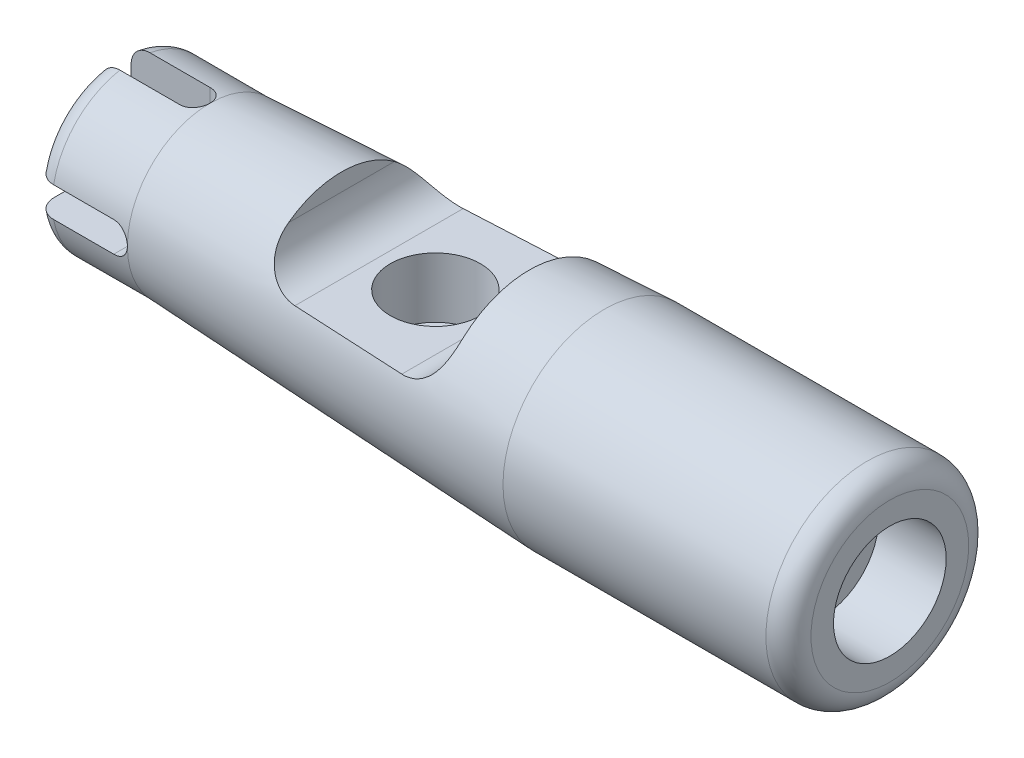
from build123d import *

# Parameters (mm, degrees)
CUT_EXTRUDE1_DEPTH                       = 210.50894969
FILLET1_R                                = 5
CIRPATTERN1_COUNT                        = 2
CIRPATTERN1_ANGLE                        = 90
CBORE_FOR_M30_HEX_HEAD_BOLT2_D           = 12
CBORE_FOR_M30_HEX_HEAD_BOLT2_DEPTH       = 38
CBORE_FOR_M30_HEX_HEAD_BOLT2_CBORE_D     = 30
CBORE_FOR_M30_HEX_HEAD_BOLT2_CBORE_DEPTH = 18
CBORE_FOR_M30_HEX_HEAD_BOLT2_TIP         = 3.605163714
FILLET2_R                                = 6
CUT_EXTRUDE2_DEPTH                       = 210.508949801
CUT_EXTRUDE2_DEPTH_BACK                  = 210.508949801
SKETCH10_W                               = 60
SKETCH10_H                               = 5
FILLET3_R                                = 5
CUT_EXTRUDE3_DEPTH                       = 214.461940534
CUT_EXTRUDE3_DEPTH_BACK                  = 12
SKETCH11_R                               = 3
CUT_EXTRUDE4_DEPTH                       = 210.508949814
CUT_EXTRUDE4_DEPTH_BACK                  = 210.508949814
SKETCH12_W                               = 50
SKETCH12_H                               = 18
FILLET4_R                                = 10
SKETCH13_R                               = 12
CUT_EXTRUDE5_DEPTH                       = 16


with BuildPart() as part:
    # Sketch1 → Revolve1 (revolve)
    with BuildSketch(Plane.XY, mode=Mode.PRIVATE) as revolve1_sk:
        Polygon((0, 0), (0, 27), (-76, 27), (-181, 22), (-206, 22), (-206, 0), align=None)
    revolve(revolve1_sk.sketch.rotate(Axis((0, 0, 0), (-1, 0, 0)), 90), axis=Axis((0, 0, 0), (-1, 0, 0)))

    # Sketch2 → Cut-Extrude1 (cut, symmetric)
    with BuildSketch(Plane.XY):
        with BuildLine():
            Line((-206, 4), (-185, 4))
            ThreePointArc((-185, 4), (-181, 0), (-185, -4))
            Line((-185, -4), (-206, -4))
            ThreePointArc((-206, -4), (-210, 0), (-206, 4))
        make_face()
    cut_extrude1 = extrude(amount=CUT_EXTRUDE1_DEPTH, both=True, mode=Mode.SUBTRACT)

    # Fillet1
    fillet1_edges = [part.edges().sort_by_distance(p)[0] for p in [
        (-206, -22, 0),
        (-206, 22, 0),
    ]]
    fillet(fillet1_edges, radius=FILLET1_R)

    # CirPattern1: Cut-Extrude1 ×2 about axis
    cirpattern1_axis = Axis((0, 0, 0), (1, 0, 0))
    for i in range(1, CIRPATTERN1_COUNT):
        add(cut_extrude1.rotate(cirpattern1_axis, i * CIRPATTERN1_ANGLE / (CIRPATTERN1_COUNT - 1)), mode=Mode.SUBTRACT)

    # CBORE for M30 Hex Head Bolt2
    with Locations(Plane(origin=(0, 0, 0), x_dir=(0, 0, -1), z_dir=(1, 0, 0))):
        with Locations((0, 0)):
            CounterBoreHole(CBORE_FOR_M30_HEX_HEAD_BOLT2_D / 2, CBORE_FOR_M30_HEX_HEAD_BOLT2_CBORE_D / 2, CBORE_FOR_M30_HEX_HEAD_BOLT2_CBORE_DEPTH, depth=CBORE_FOR_M30_HEX_HEAD_BOLT2_DEPTH)
            with Locations((0, 0, -(CBORE_FOR_M30_HEX_HEAD_BOLT2_DEPTH + CBORE_FOR_M30_HEX_HEAD_BOLT2_TIP / 2))):  # 118° drill point
                Cone(0, CBORE_FOR_M30_HEX_HEAD_BOLT2_D / 2, CBORE_FOR_M30_HEX_HEAD_BOLT2_TIP, mode=Mode.SUBTRACT)

    # Fillet2
    fillet2_edges = [part.edges().sort_by_distance(p)[0] for p in [
        (0, 0, 27),
    ]]
    fillet(fillet2_edges, radius=FILLET2_R)

    # Sketch10 → Cut-Extrude2 (cut, two sides: drawn at the far end of the back side and taken through both)
    with BuildSketch(Plane.XY.offset(-CUT_EXTRUDE2_DEPTH_BACK)):
        with Locations((-46, -24.5)):
            Rectangle(SKETCH10_W, SKETCH10_H)
    extrude(amount=CUT_EXTRUDE2_DEPTH + CUT_EXTRUDE2_DEPTH_BACK, mode=Mode.SUBTRACT)

    # Fillet3
    # the kernel refuses this fillet: 5 mm, written as the material it adds along each edge
    with BuildSketch(Plane(origin=(-16, -22, -28.152475842), x_dir=(0, -1, 0), z_dir=(0, 0, 1))) as fillet3_piece_1_section:
        with BuildLine():
            CenterArc((FILLET3_R, -FILLET3_R), FILLET3_R, 90, 90)
            Line((0, -FILLET3_R), (0, 0))
            Line((0, 0), (FILLET3_R, 0))
        make_face()
    fillet3_piece_1 = extrude(amount=56.304951685, mode=Mode.PRIVATE)
    fillet3_piece_1 = fillet3_piece_1 & Plane(origin=(-17.184070589, 0, 0), x_dir=(0, 0, -1), z_dir=(-1, 0, 0)) * Cylinder(27, 133, mode=Mode.PRIVATE)
    add(fillet3_piece_1)
    with BuildSketch(Plane(origin=(-76, -22, 28.152475842), x_dir=(1, 0, 0), z_dir=(0, 0, -1))) as fillet3_piece_2_section:
        with BuildLine():
            CenterArc((FILLET3_R, FILLET3_R), FILLET3_R, 180, 90)
            Line((0, FILLET3_R), (0, 0))
            Line((0, 0), (FILLET3_R, 0))
        make_face()
    fillet3_piece_2 = extrude(amount=56.304951685, mode=Mode.PRIVATE)
    fillet3_piece_2 = fillet3_piece_2 & Plane(origin=(-74.861034645, 0, 0), x_dir=(0, 0, -1), z_dir=(-1, 0, 0)) * Cylinder(27, 133, mode=Mode.PRIVATE)
    add(fillet3_piece_2)

    # Sketch11 → Cut-Extrude3 (cut, two sides: drawn at the far end of the back side and taken through both)
    with BuildSketch(Plane.XZ.offset(22).offset(-CUT_EXTRUDE3_DEPTH_BACK)):
        with Locations(Location((-46, 12, 0), (0, 0, 180))):
            Circle(SKETCH11_R)
        with Locations(Location((-46, -12, 0), (0, 0, 180))):
            Circle(SKETCH11_R)
    extrude(amount=CUT_EXTRUDE3_DEPTH + CUT_EXTRUDE3_DEPTH_BACK, mode=Mode.SUBTRACT)

    # Sketch12 → Cut-Extrude4 (cut, two sides: drawn at the far end of the back side and taken through both)
    with BuildSketch(Plane.XY.offset(-CUT_EXTRUDE4_DEPTH_BACK)):
        with Locations((-121, 18)):
            Rectangle(SKETCH12_W, SKETCH12_H)
    extrude(amount=CUT_EXTRUDE4_DEPTH + CUT_EXTRUDE4_DEPTH_BACK, mode=Mode.SUBTRACT)

    # Fillet4
    fillet4_edges = [part.edges().sort_by_distance(p)[0] for p in [
        (-96, 9, 0),
        (-146, 9, 0),
    ]]
    fillet(fillet4_edges, radius=FILLET4_R)

    # Sketch13 → Cut-Extrude5 (cut)
    with BuildSketch(Plane(origin=(0, 9, 0), x_dir=(1, 0, 0), z_dir=(0, 1, 0))):
        with Locations(Location((-121, 0, 0), (0, 0, 180))):
            Circle(SKETCH13_R)
    extrude(amount=-CUT_EXTRUDE5_DEPTH, mode=Mode.SUBTRACT)


solid = part.part
